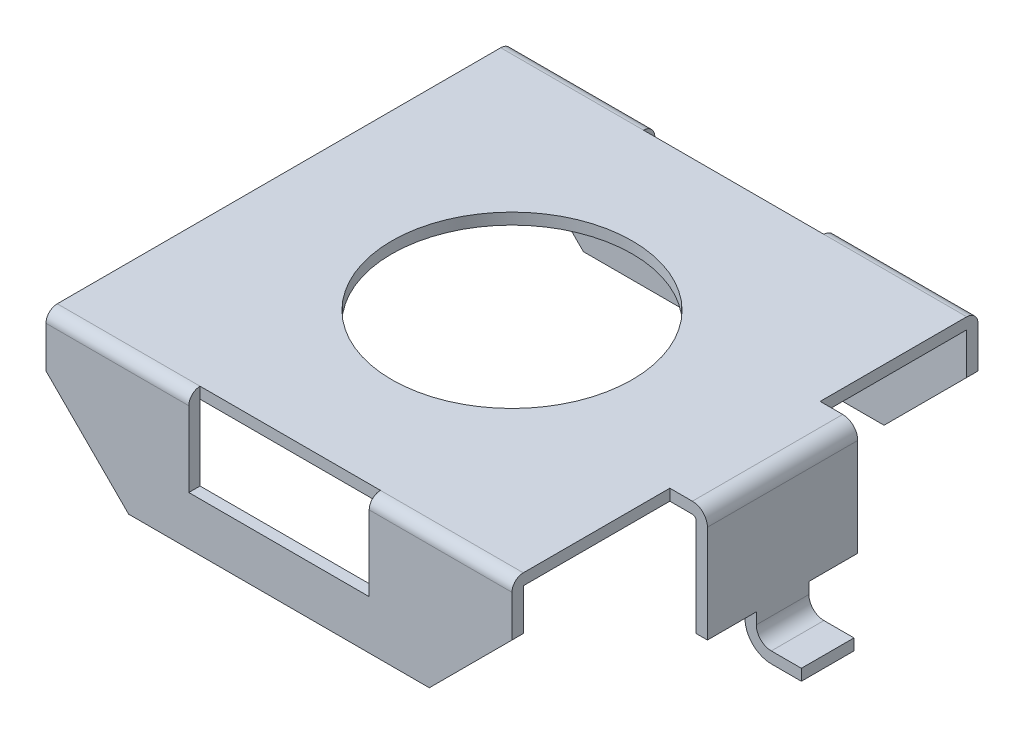
from build123d import *

# Parameters (mm, degrees)
EXTRUDE_THIN3_DEPTH     = 3.1
CUT_EXTRUDE1_DEPTH      = 5.818713521
CUT_EXTRUDE1_DEPTH_BACK = 5.818713521
SKETCH2_W               = 2.4
SKETCH2_H               = 1
SKETCH3_W               = 2.4
SKETCH3_H               = 0.15
CUT_EXTRUDE2_DEPTH      = 1
FILLET1_R               = 0.15
SKETCH4_R               = 1.6
CUT_EXTRUDE3_DEPTH      = 1
EXTRUDE_THIN4_DEPTH     = 1
SKETCH6_W               = 1
SKETCH6_H               = 0.65
CUT_EXTRUDE4_DEPTH      = 0.5


with BuildPart() as part:
    # Sketch1 → Extrude-Thin3 (new, symmetric)
    with BuildSketch(Plane(origin=(0, 0, 0), x_dir=(0, 0, -1), z_dir=(1, 0, 0))):
        Polygon((-3.1, 0.2), (-3.1, 2), (3.1, 2), (3.1, 0.2), (2.95, 0.2), (2.95, 1.85), (-2.95, 1.85), (-2.95, 0.2), align=None)
    extrude(amount=EXTRUDE_THIN3_DEPTH, both=True)

    # Sketch2 → Cut-Extrude1 (cut, two sides: drawn at the far end of the back side and taken through both)
    with BuildSketch(Plane.XY.offset(-CUT_EXTRUDE1_DEPTH_BACK)):
        with Locations((0, 1.35)):
            Rectangle(SKETCH2_W, SKETCH2_H)
        Polygon((-3.1, 1.3), (-2, 0.2), (-3.1, 0.2), align=None)
        Polygon((3.1, 0.2), (3.1, 1.3), (2, 0.2), align=None)
    extrude(amount=CUT_EXTRUDE1_DEPTH + CUT_EXTRUDE1_DEPTH_BACK, mode=Mode.SUBTRACT)

    # Sketch3 → Cut-Extrude2 (cut)
    with BuildSketch(Plane(origin=(0, 2, 0), x_dir=(1, 0, 0), z_dir=(0, 1, 0))):
        with Locations((0, 3.025)):
            Rectangle(SKETCH3_W, SKETCH3_H)
        with Locations((0, -3.025)):
            Rectangle(SKETCH3_W, SKETCH3_H)
    extrude(amount=-CUT_EXTRUDE2_DEPTH, mode=Mode.SUBTRACT)

    # Fillet1
    fillet1_edges = [part.edges().sort_by_distance(p)[0] for p in [
        (-2.15, 2, -3.1),
        (2.15, 2, -3.1),
        (-2.15, 2, 3.1),
        (2.15, 2, 3.1),
    ]]
    fillet(fillet1_edges, radius=FILLET1_R)

    # Sketch4 → Cut-Extrude3 (cut)
    with BuildSketch(Plane(origin=(0, 2, 0), x_dir=(1, 0, 0), z_dir=(0, 1, 0))):
        Circle(SKETCH4_R)
    extrude(amount=-CUT_EXTRUDE3_DEPTH, mode=Mode.SUBTRACT)

    # Sketch5 → Extrude-Thin4 (add, symmetric)
    with BuildSketch(Plane.XY):
        with BuildLine():
            Line((3.1, 2), (3.4, 2))
            ThreePointArc((3.4, 2), (3.541421356, 1.941421356), (3.6, 1.8))
            Line((3.6, 1.8), (3.6, 0.35))
            ThreePointArc((3.6, 0.35), (3.658578644, 0.208578644), (3.8, 0.15))
            Line((3.8, 0.15), (4.2, 0.15))
            Line((4.2, 0.15), (4.2, 0))
            Line((4.2, 0), (3.8, 0))
            ThreePointArc((3.8, 0), (3.552512627, 0.102512627), (3.45, 0.35))
            Line((3.45, 0.35), (3.45, 1.8))
            ThreePointArc((3.45, 1.8), (3.435355339, 1.835355339), (3.4, 1.85))
            Line((3.4, 1.85), (3.1, 1.85))
            Line((3.1, 1.85), (3.1, 2))
        make_face()
    extrude(amount=EXTRUDE_THIN4_DEPTH, both=True)

    # Sketch6 → Cut-Extrude4 (cut)
    with BuildSketch(Plane.XZ):
        with Locations((3.7, 0.675)):
            Rectangle(SKETCH6_W, SKETCH6_H)
        with Locations((3.7, -0.675)):
            Rectangle(SKETCH6_W, SKETCH6_H)
    extrude(amount=-CUT_EXTRUDE4_DEPTH, mode=Mode.SUBTRACT)


solid = part.part
